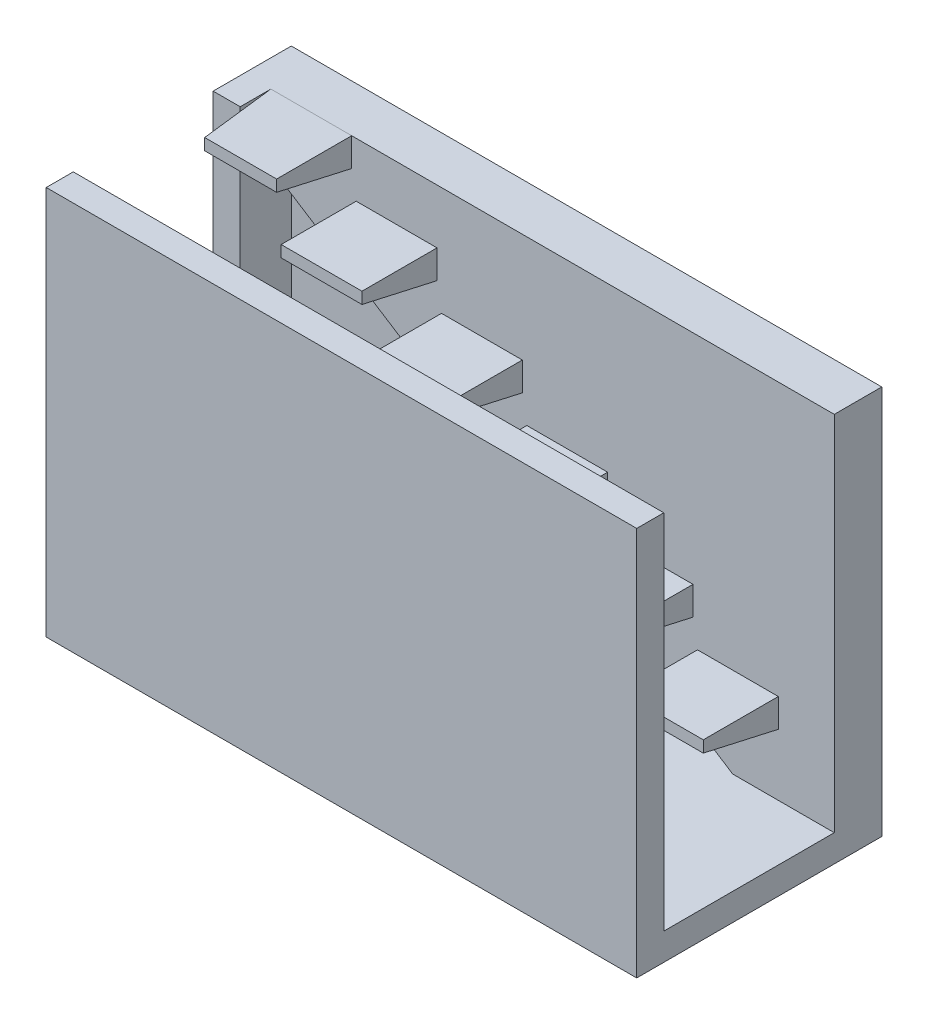
from build123d import *

# Parameters (mm, degrees)
SALIENTE_EXTRUIR1_DEPTH  = 2040
CROQUIS2_W               = 3324.8
CROQUIS2_H               = 1379.8
SALIENTE_EXTRUIR2_DEPTH  = 152.4
SALIENTE_EXTRUIR3_DEPTH  = 115
CROQUIS13_W              = 960
CROQUIS13_H              = 2040
CORTAR_EXTRUIR4_DEPTH    = 3835.277476918
CROQUIS14_W              = 2600.666666667
CROQUIS14_H              = 95
SALIENTE_EXTRUIR5_DEPTH  = 15
SALIENTE_EXTRUIR19_DEPTH = 455
CORTAR_EXTRUIR7_DEPTH    = 196
MATRIZL8_COUNT           = 6
MATRIZL8_PITCH           = 570


with BuildPart() as part:
    # Croquis1 → Saliente-Extruir1 (new body)
    with BuildSketch(Plane(origin=(0, 0, 0), x_dir=(1, 0, 0), z_dir=(0, 1, 0))):
        Polygon((1662.4, 689.9), (1662.4, -689.9), (-1662.4, -689.9), (-1662.4, -537.5), (-1510, -537.5), (1510, -537.5), (1510, 537.5), (-1510, 537.5), (-1510, 249.9), (-1662.4, 249.9), (-1662.4, 689.9), align=None)
    extrude(amount=SALIENTE_EXTRUIR1_DEPTH)

    # Croquis2 → Saliente-Extruir2 (add)
    with BuildSketch(Plane.XZ):
        Rectangle(CROQUIS2_W, CROQUIS2_H)
    extrude(amount=SALIENTE_EXTRUIR2_DEPTH)

    # Croquis5 → Saliente-Extruir3 (add)
    with BuildSketch(Plane.XY.offset(-537.5)):
        Polygon((-1510, 1660), (1090.666666667, 0), (1510, 0), (1510, 2040), (-1510, 2040), align=None)
    extrude(amount=SALIENTE_EXTRUIR3_DEPTH)

    # Croquis13 → Cortar-Extruir4 (cut, through all)
    with BuildSketch(Plane.ZY.offset(-1510)):
        with Locations((57.5, 1020)):
            Rectangle(CROQUIS13_W, CROQUIS13_H)
    extrude(amount=-CORTAR_EXTRUIR4_DEPTH, mode=Mode.SUBTRACT)

    # Croquis14 → Saliente-Extruir5 (add)
    with BuildSketch(Plane.XY.offset(-537.5)):
        with Locations((-209.666666666, 47.5)):
            Rectangle(CROQUIS14_W, CROQUIS14_H)
    extrude(amount=SALIENTE_EXTRUIR5_DEPTH)


with BuildPart() as body_2:
    # Croquis28 → Saliente-Extruir19 (new body)
    with BuildSketch(Plane(origin=(-1510, 0, 0), x_dir=(0, 0, -1), z_dir=(1, 0, 0))):
        Polygon((422.5, 1880), (422.5, 2040), (0, 2040), (0, 1975), align=None)
    saliente_extruir19 = extrude(amount=SALIENTE_EXTRUIR19_DEPTH)

    # Croquis29 → Cortar-Extruir7 (cut)
    with BuildSketch(Plane(origin=(0, 2040, 0), x_dir=(1, 0, 0), z_dir=(0, 1, 0))):
        Polygon((-1510, 422.5), (-1510, 0), (-1460, 0), align=None)
    extrude(amount=-CORTAR_EXTRUIR7_DEPTH, mode=Mode.SUBTRACT)


with BuildPart() as matrizl8_1:
    # MatrizL8: Saliente-Extruir19 ×6
    with Locations(*[Vector(0.8429222095775886, -0.5380354529218646, 0) * (i * MATRIZL8_PITCH) for i in range(1, MATRIZL8_COUNT)]):
        add(saliente_extruir19)


solid = Compound([part.part, body_2.part, matrizl8_1.part])
